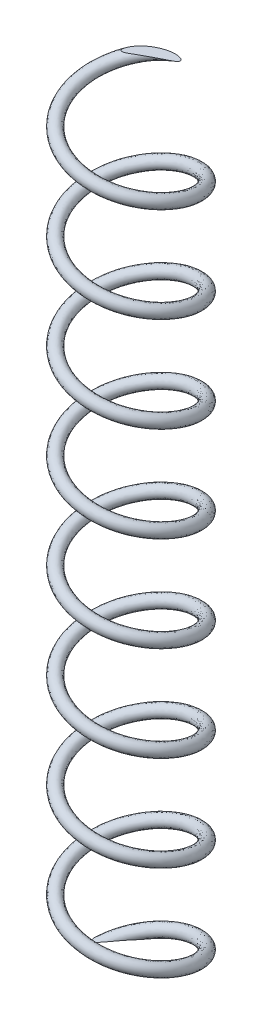
from build123d import *

# Parameters (mm, degrees)
SWEEP1_PITCH        = 6.2
SWEEP1_HEIGHT       = 248
SWEEP1_RADIUS       = 3.5
SWEEP1_START_ANGLE  = -135
SKETCH3_R           = 0.4
SKETCH5_OUTSIDE_W   = 59.596
SKETCH5_OUTSIDE_H   = 300.572
SKETCH5_OUTSIDE_W_2 = 60.9902652
SKETCH5_OUTSIDE_H_2 = 50
CUT_EXTRUDE2_DEPTH  = 25


with BuildPart() as part:
    # Sweep1: sweep along a helix
    with BuildLine() as sweep1_path:
        add(Helix(SWEEP1_PITCH, SWEEP1_HEIGHT, SWEEP1_RADIUS, center=(0, 0, 0), direction=(0, 1, 0), lefthand=True, mode=Mode.PRIVATE).rotate(Axis((0, 0, 0), (0, 1, 0)), SWEEP1_START_ANGLE))
    # Sketch3 → Sweep1 (sweep)
    with BuildSketch(Plane(origin=(-2.474873734, 0, -2.474873734), x_dir=(-0.7326775235254215, 0.25205720913943114, -0.6321794126998258), z_dir=(0.6805759667521735, 0.2713534723541835, -0.6805759667521856))):
        with Locations((-0.001432125, 0.004388281)):
            Circle(SKETCH3_R)
    sweep(path=sweep1_path.line, is_frenet=True)

    # Sketch5 outside → Cut-Extrude2 (cut, symmetric)
    with BuildSketch(Plane.XY):
        with Locations((0, 124.004)):
            Rectangle(SKETCH5_OUTSIDE_W, SKETCH5_OUTSIDE_H)
        with Locations((0.228545829, 124.090281025)):
            Rectangle(SKETCH5_OUTSIDE_W_2, SKETCH5_OUTSIDE_H_2, mode=Mode.SUBTRACT)
    extrude(amount=CUT_EXTRUDE2_DEPTH, both=True, mode=Mode.SUBTRACT)


solid = part.part
